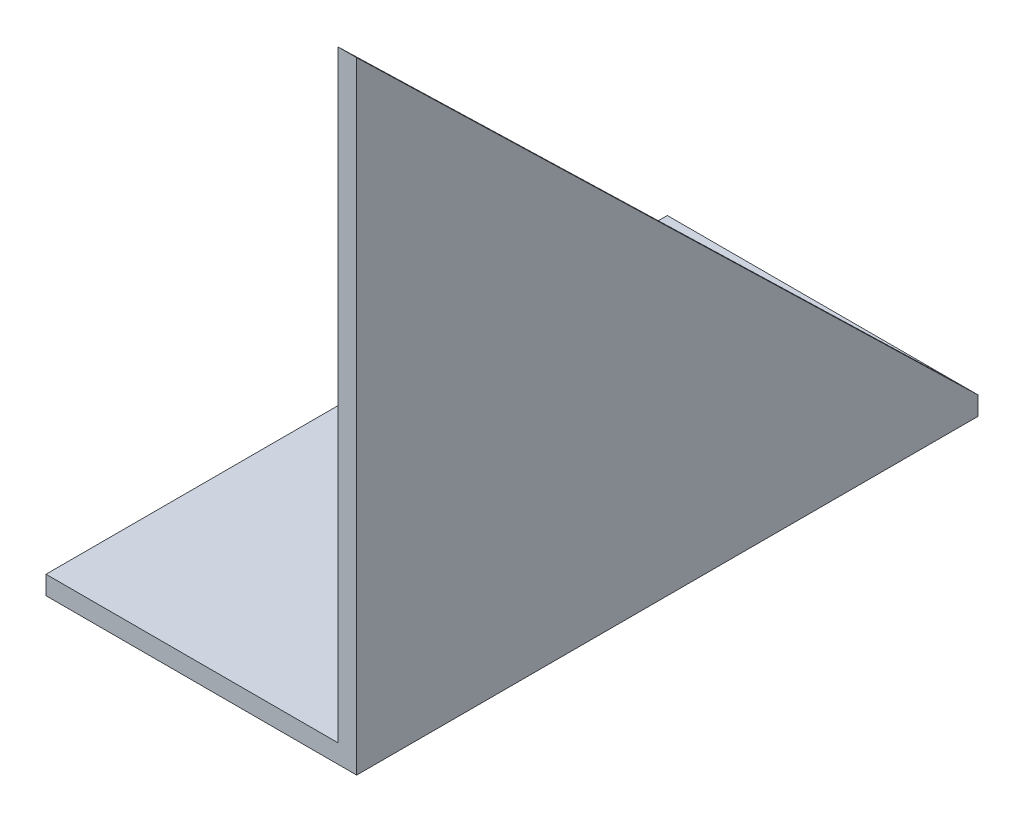
from build123d import *

# Parameters (mm, degrees)
SALIENTE_EXTRUIR1_DEPTH = 50
CORTAR_EXTRUIR2_DEPTH   = 100


with BuildPart() as part:
    # Croquis1 → Saliente-Extruir1 (new, symmetric)
    with BuildSketch(Plane.XY):
        Polygon((1.5, -50), (1.5, 50), (-1.5, 50), (-1.5, -47), (-48.5, -47), (-48.5, -50), align=None)
    extrude(amount=SALIENTE_EXTRUIR1_DEPTH, both=True)

    # Croquis3 → Cortar-Extruir2 (cut)
    with BuildSketch(Plane.ZY.offset(1.5)):
        Polygon((-50, -47), (50, 50), (-50, 50), align=None)
    extrude(amount=-CORTAR_EXTRUIR2_DEPTH, mode=Mode.SUBTRACT)


solid = part.part
